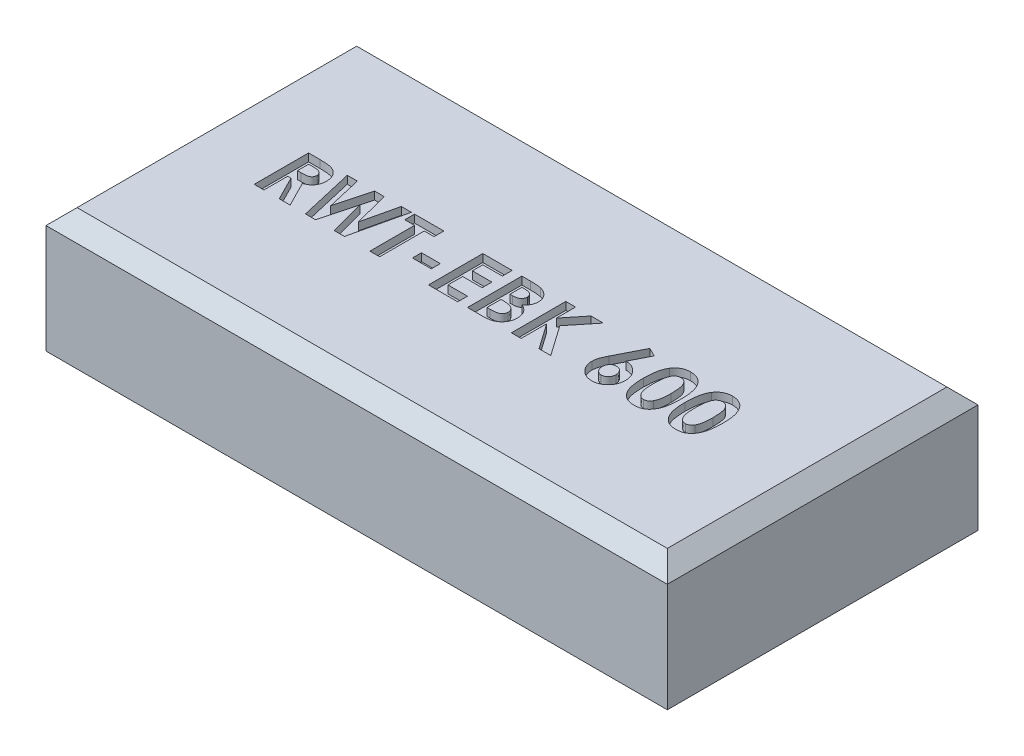
from build123d import *

# Parameters (mm, degrees)
SKETCH1_W           = 40
SKETCH1_H           = 20
BOSS_EXTRUDE1_DEPTH = 8
CHAMFER1_SIZE       = 1
SKETCH4_W           = 1.211538461
SKETCH4_H           = 0.583333333
CUT_EXTRUDE3_DEPTH  = 0.5


with BuildPart() as part:
    # Sketch1 → Boss-Extrude1 (new body)
    with BuildSketch(Plane(origin=(0, 0, 0), x_dir=(1, 0, 0), z_dir=(0, 1, 0))):
        with Locations((0, 2.318501171)):
            Rectangle(SKETCH1_W, SKETCH1_H)
    extrude(amount=BOSS_EXTRUDE1_DEPTH)

    # Chamfer1
    chamfer1_edges = [part.edges().sort_by_distance(p)[0] for p in [
        (0, 8, 7.681498829),
        (-20, 8, -2.318501171),
        (0, 8, -12.318501171),
        (20, 8, -2.318501171),
    ]]
    chamfer(chamfer1_edges, length=CHAMFER1_SIZE)

    # Sketch4 → Cut-Extrude3 (cut)
    # profile 1 of 10: a face of its own
    with BuildSketch(Plane(origin=(0, 8, 0), x_dir=(1, 0, 0), z_dir=(0, 1, 0))):
        with BuildLine():
            Line((-14.596153846, 3.818501171), (-13.864182692, 3.818501171))
            add(Edge.make_bspline(
                [(-13.864182692, 3.818501171), (-13.815799622, 3.818329439), (-13.722745349, 3.81799915), (-13.588566169, 3.81278806), (-13.46530414, 3.805536401), (-13.352776761, 3.794470177), (-13.251032173, 3.779797701), (-13.159968404, 3.76250128), (-13.079588115, 3.742788301), (-13.009213411, 3.718224373), (-12.945703721, 3.690516634), (-12.886503859, 3.658679935), (-12.830307791, 3.623068786), (-12.777491125, 3.582746162), (-12.727594872, 3.538437457), (-12.6805249, 3.49009807), (-12.636946351, 3.437318103), (-12.597129066, 3.380431058), (-12.560838815, 3.320587191), (-12.528765845, 3.257704336), (-12.502684052, 3.191738763), (-12.479637993, 3.123643816), (-12.463038663, 3.052446065), (-12.451494071, 2.978838632), (-12.443041573, 2.902562411), (-12.442555595, 2.850743733), (-12.442307692, 2.824310466)],
                knots=[0, 0, 0, 0, 1.749336639, 3.364467119, 4.854658419, 6.213483162, 7.451590619, 8.570285859, 9.5643256, 10.440900261, 11.26203566, 12.067320669, 12.869050712, 13.665104639, 14.467235401, 15.27997916, 16.102287765, 16.939272006, 17.78853747, 18.631303466, 19.488103222, 20.351255419, 21.228522269, 22.127379805, 23.044756219, 24, 24, 24, 24], degree=3))
            add(Edge.make_bspline(
                [(-12.442307692, 2.824310466), (-12.442951654, 2.796720207), (-12.444214347, 2.742620739), (-12.451015895, 2.663153032), (-12.46344699, 2.587123888), (-12.48227569, 2.514755912), (-12.503916836, 2.4451484), (-12.532694008, 2.379585653), (-12.565171892, 2.317114157), (-12.603744925, 2.258617595), (-12.646076944, 2.20279664), (-12.695308193, 2.151790002), (-12.748249241, 2.102856265), (-12.807876098, 2.059060474), (-12.871560358, 2.017441316), (-12.940567358, 1.979723274), (-13.014446736, 1.944958206), (-13.066387598, 1.925570802), (-13.092948718, 1.91565662)],
                knots=[0, 0, 0, 0, 1.099860209, 2.156625411, 3.176576793, 4.16617041, 5.135385252, 6.078461593, 7.016046972, 7.938469504, 8.868247731, 9.803980173, 10.76021508, 11.73834243, 12.748633912, 13.790971185, 14.870363756, 16, 16, 16, 16], degree=3))
            Line((-13.092948718, 1.91565662), (-12.28525641, 0.318501171))
            Line((-12.28525641, 0.318501171), (-12.983573718, 0.318501171))
            Line((-12.983573718, 0.318501171), (-13.754807692, 1.844142197))
            Line((-13.754807692, 1.844142197), (-13.967948718, 1.844142197))
            Line((-13.967948718, 1.844142197), (-13.967948718, 0.318501171))
            Line((-13.967948718, 0.318501171), (-14.596153846, 0.318501171))
            Line((-14.596153846, 0.318501171), (-14.596153846, 3.818501171))
        make_face()
        with BuildLine():
            Line((-13.967948718, 2.472347325), (-13.723257212, 2.472347325))
            add(Edge.make_bspline(
                [(-13.723257212, 2.472347325), (-13.693341641, 2.472684254), (-13.636059751, 2.473329401), (-13.55368087, 2.476321861), (-13.4788612, 2.483532211), (-13.41127944, 2.492642218), (-13.350595524, 2.503161037), (-13.297350732, 2.518235143), (-13.250724642, 2.534387429), (-13.211269776, 2.554460531), (-13.177560445, 2.577288002), (-13.148454596, 2.603220576), (-13.124379885, 2.633234229), (-13.104565169, 2.666513318), (-13.089151475, 2.70335219), (-13.07790066, 2.743346436), (-13.071613117, 2.786951643), (-13.070889714, 2.817045173), (-13.070512821, 2.832723927)],
                knots=[0, 0, 0, 0, 1.688639943, 3.233382647, 4.650958383, 5.928841754, 7.082724185, 8.122798841, 9.049171256, 9.863274652, 10.613301712, 11.341792392, 12.054588806, 12.776240173, 13.521029143, 14.301969904, 15.115324896, 16, 16, 16, 16], degree=3))
            add(Edge.make_bspline(
                [(-13.070512821, 2.832723927), (-13.071225372, 2.851273039), (-13.072625049, 2.88770933), (-13.086514186, 2.940164814), (-13.108622693, 2.988715953), (-13.1389274, 3.033143381), (-13.177092239, 3.072091531), (-13.220889403, 3.106424636), (-13.27126414, 3.133572687), (-13.317907356, 3.151479252), (-13.36034178, 3.162192934), (-13.398637509, 3.170176676), (-13.442984193, 3.175834983), (-13.493415313, 3.181836624), (-13.549802317, 3.185728385), (-13.612452548, 3.188568594), (-13.681186076, 3.189730664), (-13.729099873, 3.190102157), (-13.754106571, 3.190296043)],
                knots=[0, 0, 0, 0, 1.020303359, 2.004196876, 2.966617323, 3.9489082, 4.950758222, 5.960522915, 7.003732012, 8.091992268, 8.70421221, 9.413913587, 10.24622431, 11.166358409, 12.212345909, 13.359657661, 14.621978493, 16, 16, 16, 16], degree=3))
            Line((-13.754106571, 3.190296043), (-13.967948718, 3.190296043))
            Line((-13.967948718, 3.190296043), (-13.967948718, 2.472347325))
        make_face(mode=Mode.SUBTRACT)
    # profile 2 of 10: a face of its own
    with BuildSketch(Plane(origin=(0, 8, 0), x_dir=(1, 0, 0), z_dir=(0, 1, 0))):
        Polygon((-12.105769231, 3.818501171), (-11.457231571, 3.818501171), (-10.939102564, 1.584026011), (-10.345252404, 3.818501171), (-9.734575321, 3.818501171), (-9.144230769, 1.584026011), (-8.627504006, 3.818501171), (-7.977564103, 3.818501171), (-8.787359776, 0.318501171), (-9.443609776, 0.318501171), (-10.041666667, 2.581021203), (-10.643229167, 0.318501171), (-11.294571314, 0.318501171), align=None)
    # profile 3 of 10: a face of its own
    with BuildSketch(Plane(origin=(0, 8, 0), x_dir=(1, 0, 0), z_dir=(0, 1, 0))):
        Polygon((-7.775641026, 3.818501171), (-5.891025641, 3.818501171), (-5.891025641, 3.190296043), (-6.519230769, 3.190296043), (-6.519230769, 0.318501171), (-7.147435897, 0.318501171), (-7.147435897, 3.190296043), (-7.775641026, 3.190296043), align=None)
    # profile 4 of 10: a face of its own
    with BuildSketch(Plane(origin=(0, 8, 0), x_dir=(1, 0, 0), z_dir=(0, 1, 0))):
        with Locations((-4.791666667, 1.597347325)):
            Rectangle(SKETCH4_W, SKETCH4_H)
    # profile 5 of 10: a face of its own
    with BuildSketch(Plane(origin=(0, 8, 0), x_dir=(1, 0, 0), z_dir=(0, 1, 0))):
        Polygon((-3.378205128, 3.818501171), (-1.493589744, 3.818501171), (-1.493589744, 3.190296043), (-2.75, 3.190296043), (-2.75, 2.51721912), (-1.493589744, 2.51721912), (-1.493589744, 1.889013991), (-2.75, 1.889013991), (-2.75, 0.946706299), (-1.493589744, 0.946706299), (-1.493589744, 0.318501171), (-3.378205128, 0.318501171), align=None)
    # profile 6 of 10: a face of its own
    with BuildSketch(Plane(origin=(0, 8, 0), x_dir=(1, 0, 0), z_dir=(0, 1, 0))):
        with BuildLine():
            Line((-0.865384615, 0.318501171), (-0.865384615, 3.818501171))
            Line((-0.865384615, 3.818501171), (-0.304487179, 3.818501171))
            add(Edge.make_bspline(
                [(-0.304487179, 3.818501171), (-0.265220852, 3.818505652), (-0.189241252, 3.818514323), (-0.079622519, 3.814664873), (0.022039599, 3.809685178), (0.115421572, 3.804114058), (0.200682344, 3.794513904), (0.277692262, 3.784396391), (0.346605192, 3.772195293), (0.389210312, 3.76125053), (0.409254808, 3.756101331)],
                knots=[0, 0, 0, 0, 1.311965854, 2.538629056, 3.664479157, 4.713267157, 5.663616078, 6.530575999, 7.308677837, 8, 8, 8, 8], degree=3))
            add(Edge.make_bspline(
                [(0.409254808, 3.756101331), (0.435575266, 3.748838294), (0.487224455, 3.734585883), (0.561202576, 3.705802524), (0.631381143, 3.673807779), (0.697674471, 3.637307759), (0.759675491, 3.595861807), (0.817148578, 3.549140995), (0.871333285, 3.499020694), (0.920305637, 3.444104065), (0.964568575, 3.386074475), (1.003025131, 3.324947127), (1.03643895, 3.2616567), (1.063178757, 3.195406725), (1.083326699, 3.126502301), (1.09806282, 3.055237661), (1.107613822, 2.981387306), (1.108516267, 2.931144495), (1.108974359, 2.905640594)],
                knots=[0, 0, 0, 0, 1.099996261, 2.158545794, 3.195537121, 4.207578794, 5.205712374, 6.197378256, 7.190519799, 8.17788031, 9.159561366, 10.129234751, 11.085776129, 12.040971148, 13.00380137, 13.975669004, 14.972423361, 16, 16, 16, 16], degree=3))
            add(Edge.make_bspline(
                [(1.108974359, 2.905640594), (1.107776583, 2.872874775), (1.105418909, 2.808379286), (1.090357925, 2.713647082), (1.062116233, 2.624111532), (1.025162666, 2.538122532), (0.974917368, 2.456000819), (0.911115557, 2.377785442), (0.834790614, 2.30106803), (0.776245169, 2.255081117), (0.745793269, 2.231161427)],
                knots=[0, 0, 0, 0, 0.986156485, 1.941127874, 2.875419072, 3.804401753, 4.751181392, 5.761612777, 6.835722519, 8, 8, 8, 8], degree=3))
            add(Edge.make_bspline(
                [(0.745793269, 2.231161427), (0.770470028, 2.218564156), (0.818854324, 2.193864392), (0.887545811, 2.153265354), (0.951146629, 2.110083128), (1.009941945, 2.065186558), (1.062698461, 2.016672412), (1.111594582, 1.967336144), (1.154218027, 1.914350989), (1.192333195, 1.85960544), (1.225462281, 1.802306775), (1.254314061, 1.742551757), (1.278684124, 1.680136252), (1.299321324, 1.615377904), (1.314712554, 1.548053973), (1.324747963, 1.478140383), (1.332431699, 1.405875574), (1.333029422, 1.35665059), (1.333333333, 1.331622165)],
                knots=[0, 0, 0, 0, 1.164658916, 2.283573913, 3.35186032, 4.395461096, 5.390182219, 6.362969632, 7.312859996, 8.245001507, 9.165155236, 10.092416118, 11.032087915, 11.979892451, 12.947605196, 13.931445124, 14.948243989, 16, 16, 16, 16], degree=3))
            add(Edge.make_bspline(
                [(1.333333333, 1.331622165), (1.331361149, 1.283819302), (1.327469051, 1.189480545), (1.29901193, 1.050969584), (1.249676325, 0.91964863), (1.18342878, 0.796039608), (1.101799059, 0.683720797), (1.007948289, 0.585330494), (0.902821331, 0.502045287), (0.805829006, 0.445834233), (0.721938284, 0.40811136), (0.652453165, 0.384788701), (0.577827621, 0.363182624), (0.49669469, 0.348010391), (0.410525202, 0.334123096), (0.318478999, 0.325548791), (0.220728113, 0.319738197), (0.153588579, 0.318921849), (0.118990385, 0.318501171)],
                knots=[0, 0, 0, 0, 1.284142165, 2.534249414, 3.780121997, 5.041676246, 6.291546858, 7.49970053, 8.684500223, 9.883330709, 10.50184324, 11.153274765, 11.851151195, 12.587658647, 13.369265475, 14.195992086, 15.070362669, 16, 16, 16, 16], degree=3))
            Line((0.118990385, 0.318501171), (-0.865384615, 0.318501171))
        make_face()
        with BuildLine():
            Line((-0.237179487, 3.190296043), (-0.237179487, 2.42747553))
            Line((-0.237179487, 2.42747553), (-0.0703125, 2.42747553))
            add(Edge.make_bspline(
                [(-0.0703125, 2.42747553), (-0.047633777, 2.427673297), (-0.003853875, 2.428055074), (0.059381549, 2.432972233), (0.118180282, 2.441361212), (0.172319311, 2.453065948), (0.222302963, 2.467929257), (0.267811927, 2.485813017), (0.308646108, 2.507633149), (0.356085982, 2.540135198), (0.406233349, 2.587963419), (0.450377513, 2.657061193), (0.476378131, 2.736523371), (0.479273899, 2.792566252), (0.480769231, 2.821505979)],
                knots=[0, 0, 0, 0, 1.065314748, 2.056525647, 2.977365736, 3.853934255, 4.656397591, 5.425096493, 6.14721249, 6.826394842, 8.123232004, 9.372140726, 10.643011755, 12, 12, 12, 12], degree=3))
            add(Edge.make_bspline(
                [(0.480769231, 2.821505979), (0.479572691, 2.848612841), (0.47725923, 2.901022871), (0.451079951, 2.97461122), (0.410418355, 3.039825558), (0.362411626, 3.084459439), (0.317203962, 3.114943064), (0.278494386, 3.135015233), (0.236007719, 3.152983634), (0.188921466, 3.166722711), (0.137504514, 3.17703203), (0.082006625, 3.184602991), (0.022332045, 3.189756109), (-0.018885315, 3.190112204), (-0.040164263, 3.190296043)],
                knots=[0, 0, 0, 0, 1.347982417, 2.606269829, 3.849316587, 5.153353503, 5.842674298, 6.568177932, 7.326619318, 8.142485038, 9.012069166, 9.942760135, 10.937925643, 12, 12, 12, 12], degree=3))
            Line((-0.040164263, 3.190296043), (-0.237179487, 3.190296043))
        make_face(mode=Mode.SUBTRACT)
        with BuildLine():
            Line((-0.237179487, 1.844142197), (-0.237179487, 0.946706299))
            Line((-0.237179487, 0.946706299), (-0.056290064, 0.946706299))
            add(Edge.make_bspline(
                [(-0.056290064, 0.946706299), (-0.020527995, 0.946910607), (0.048229046, 0.947303413), (0.146723385, 0.952049449), (0.236279363, 0.960603342), (0.316659689, 0.971282188), (0.387987483, 0.985750355), (0.450021639, 1.004144774), (0.503612874, 1.02438184), (0.548439854, 1.049377018), (0.585060929, 1.078465208), (0.618107609, 1.108194036), (0.645051813, 1.142489048), (0.666370569, 1.179878054), (0.684821916, 1.219432285), (0.695950465, 1.262696318), (0.704423352, 1.308387911), (0.704889637, 1.339991798), (0.705128205, 1.356161427)],
                knots=[0, 0, 0, 0, 1.753078804, 3.370512758, 4.83203934, 6.162291463, 7.344201807, 8.395507345, 9.331626367, 10.147333109, 10.898971645, 11.62040215, 12.321813352, 13.025280112, 13.727906689, 14.453419512, 15.208716525, 16, 16, 16, 16], degree=3))
            add(Edge.make_bspline(
                [(0.705128205, 1.356161427), (0.704602095, 1.374651653), (0.703577374, 1.410665639), (0.695208464, 1.463303922), (0.67999942, 1.512445252), (0.660842888, 1.559346239), (0.634185556, 1.602327663), (0.602504228, 1.642876951), (0.564225095, 1.679620976), (0.521177978, 1.714782156), (0.470967777, 1.745567673), (0.413570936, 1.772279563), (0.348675643, 1.79458835), (0.27608088, 1.81235062), (0.196104895, 1.827425213), (0.108163951, 1.83642641), (0.012990452, 1.843120995), (-0.053004401, 1.843794061), (-0.087139423, 1.844142197)],
                knots=[0, 0, 0, 0, 0.845221588, 1.646264278, 2.427170338, 3.19324141, 3.95557735, 4.731569926, 5.540061037, 6.376114724, 7.268642756, 8.224665384, 9.265483498, 10.400594375, 11.639216012, 12.983232105, 14.439614077, 16, 16, 16, 16], degree=3))
            Line((-0.087139423, 1.844142197), (-0.237179487, 1.844142197))
        make_face(mode=Mode.SUBTRACT)
    # profile 7 of 10: a face of its own
    with BuildSketch(Plane(origin=(0, 8, 0), x_dir=(1, 0, 0), z_dir=(0, 1, 0))):
        Polygon((1.961538462, 3.818501171), (2.58974359, 3.818501171), (2.58974359, 2.586630177), (3.582532051, 3.818501171), (4.375500801, 3.818501171), (3.128205128, 2.270424248), (4.496794872, 0.318501171), (3.740284455, 0.318501171), (2.58974359, 1.959827293), (2.58974359, 0.318501171), (1.961538462, 0.318501171), align=None)
    # profile 8 of 10: a face of its own
    with BuildSketch(Plane(origin=(0, 8, 0), x_dir=(1, 0, 0), z_dir=(0, 1, 0))):
        with BuildLine():
            Line((7.287259615, 3.908244761), (7.843249199, 3.626393799))
            Line((7.843249199, 3.626393799), (7.233273237, 2.42747553))
            add(Edge.make_bspline(
                [(7.233273237, 2.42747553), (7.269310045, 2.426542519), (7.340290447, 2.4247048), (7.444723706, 2.409852053), (7.544563845, 2.384175214), (7.640817549, 2.350140634), (7.732308207, 2.304431854), (7.820509327, 2.250058876), (7.903139102, 2.183745181), (7.982092161, 2.110273125), (8.053883772, 2.028876646), (8.116247478, 1.941413544), (8.170596347, 1.850011807), (8.21284497, 1.752626555), (8.246924117, 1.650872061), (8.271513721, 1.544341567), (8.285542778, 1.432726586), (8.287476918, 1.356901473), (8.288461538, 1.31830085)],
                knots=[0, 0, 0, 0, 1.013260694, 1.995783107, 2.958651975, 3.908806537, 4.861209129, 5.829647963, 6.817170299, 7.835534541, 8.860094905, 9.863329007, 10.853101798, 11.844815043, 12.84250023, 13.867713965, 14.914507806, 16, 16, 16, 16], degree=3))
            add(Edge.make_bspline(
                [(8.288461538, 1.31830085), (8.287538867, 1.281092192), (8.285715142, 1.20754663), (8.270639637, 1.099526903), (8.246276829, 0.995888293), (8.211457485, 0.896837778), (8.167199282, 0.801891196), (8.113074498, 0.711104263), (8.048634272, 0.6251554), (7.975543562, 0.544501298), (7.895642808, 0.470984488), (7.81142306, 0.405638468), (7.722170652, 0.351660177), (7.629572559, 0.306074244), (7.531923994, 0.272057263), (7.430686271, 0.246380336), (7.325091675, 0.231563634), (7.253416769, 0.229700417), (7.217147436, 0.228757581)],
                knots=[0, 0, 0, 0, 1.049934834, 2.075270938, 3.072134561, 4.05064612, 5.033440221, 6.024524368, 7.028587226, 8.060776465, 9.092543989, 10.090062252, 11.064205434, 12.031961459, 12.998029633, 13.977230324, 14.976426867, 16, 16, 16, 16], degree=3))
            add(Edge.make_bspline(
                [(7.217147436, 0.228757581), (7.179220735, 0.229531316), (7.104643009, 0.231052761), (6.995517131, 0.248088938), (6.890856023, 0.273734527), (6.791247896, 0.31035207), (6.696073317, 0.356977567), (6.606452795, 0.414671928), (6.521631401, 0.482798942), (6.442513456, 0.559825856), (6.371234084, 0.644198302), (6.307658842, 0.731798868), (6.253874104, 0.822765019), (6.210336613, 0.916999493), (6.176367653, 1.01420201), (6.152732185, 1.114557051), (6.137331496, 1.217798425), (6.135526117, 1.287863863), (6.134615385, 1.323208703)],
                knots=[0, 0, 0, 0, 1.063775006, 2.091769615, 3.092589432, 4.084662827, 5.064601646, 6.061867366, 7.070035304, 8.113879863, 9.156342271, 10.166834137, 11.149076039, 12.117706134, 13.076241869, 14.034148791, 15.008317125, 16, 16, 16, 16], degree=3))
            add(Edge.make_bspline(
                [(6.134615385, 1.323208703), (6.135096598, 1.350579146), (6.136061702, 1.405472389), (6.145760426, 1.487672036), (6.160505893, 1.570087449), (6.17759782, 1.639632185), (6.19519736, 1.698439537), (6.212911432, 1.748206609), (6.234864121, 1.803437178), (6.259959296, 1.86427228), (6.28898611, 1.930638729), (6.321792931, 2.002355629), (6.358461434, 2.079966073), (6.384611127, 2.133272431), (6.398237179, 2.161049248)],
                knots=[0, 0, 0, 0, 1.110454016, 2.227089276, 3.35462975, 4.507227546, 5.131400587, 5.845402449, 6.650387134, 7.543487832, 8.516250726, 9.590168902, 10.744287919, 12, 12, 12, 12], degree=3))
            Line((6.398237179, 2.161049248), (7.287259615, 3.908244761))
        make_face()
        with BuildLine():
            add(Edge.make_bspline(
                [(7.203125, 1.844142197), (7.172981806, 1.842759592), (7.113995532, 1.840054016), (7.030125872, 1.81171991), (6.953655771, 1.767270749), (6.887370541, 1.705366696), (6.831929046, 1.631388922), (6.79118869, 1.547007389), (6.766681101, 1.453348146), (6.76413492, 1.387863165), (6.762820513, 1.354058062)],
                knots=[0, 0, 0, 0, 0.981744412, 1.921144944, 2.858899012, 3.85339082, 4.86292663, 5.863643845, 6.897155691, 8, 8, 8, 8], degree=3))
            add(Edge.make_bspline(
                [(6.762820513, 1.354058062), (6.764376812, 1.320241702), (6.767403918, 1.254466622), (6.792833024, 1.159915576), (6.83446836, 1.073617836), (6.892859264, 0.998659696), (6.961409347, 0.936438636), (7.037423258, 0.890423187), (7.119633057, 0.862154387), (7.176499583, 0.858705218), (7.205228365, 0.856962709)],
                knots=[0, 0, 0, 0, 1.098279937, 2.136227893, 3.159405121, 4.194678092, 5.206500211, 6.154139736, 7.067477469, 8, 8, 8, 8], degree=3))
            add(Edge.make_bspline(
                [(7.205228365, 0.856962709), (7.235569206, 0.858736253), (7.295072865, 0.862214481), (7.380910794, 0.889293782), (7.459324258, 0.934538321), (7.528656928, 0.996560175), (7.588212374, 1.070662942), (7.629418727, 1.157467583), (7.656023432, 1.252701065), (7.658813782, 1.319514894), (7.66025641, 1.354058062)],
                knots=[0, 0, 0, 0, 0.96921794, 1.900804717, 2.848419905, 3.844199796, 4.861108892, 5.867439427, 6.897452859, 8, 8, 8, 8], degree=3))
            add(Edge.make_bspline(
                [(7.66025641, 1.354058062), (7.658612993, 1.387843426), (7.655430323, 1.453272729), (7.631524703, 1.547370744), (7.588842831, 1.631427039), (7.532146927, 1.705672064), (7.463580512, 1.767548514), (7.384049921, 1.81207045), (7.296348955, 1.840003817), (7.234652722, 1.842742624), (7.203125, 1.844142197)],
                knots=[0, 0, 0, 0, 1.083229974, 2.097801324, 3.086792542, 4.086858909, 5.079819718, 6.026392613, 6.991456328, 8, 8, 8, 8], degree=3))
        make_face(mode=Mode.SUBTRACT)
    # profile 9 of 10: a face of its own
    with BuildSketch(Plane(origin=(0, 8, 0), x_dir=(1, 0, 0), z_dir=(0, 1, 0))):
        with BuildLine():
            add(Edge.make_bspline(
                [(9.915765224, 3.908244761), (9.94617296, 3.907793349), (10.005962692, 3.906905754), (10.094021714, 3.897292372), (10.178846898, 3.882769234), (10.260770092, 3.86251452), (10.339201605, 3.835708128), (10.414712276, 3.803621336), (10.48640331, 3.764571127), (10.555188998, 3.720461909), (10.621042843, 3.670524021), (10.682382094, 3.613592251), (10.740326935, 3.550976601), (10.793623075, 3.481730434), (10.843450772, 3.406483618), (10.889646302, 3.325224221), (10.931856026, 3.237554532), (10.970553014, 3.143316345), (11.005155982, 3.04109707), (11.03430202, 2.929724208), (11.059299625, 2.809172324), (11.080399367, 2.679141347), (11.096347361, 2.539458435), (11.107096631, 2.390216385), (11.114473288, 2.231702915), (11.115075319, 2.122963977), (11.115384615, 2.067098927)],
                knots=[0, 0, 0, 0, 0.879237366, 1.728815576, 2.559023295, 3.367336655, 4.166867292, 4.954216142, 5.737608147, 6.525189134, 7.316157332, 8.124696809, 8.942788509, 9.781158001, 10.649253743, 11.551476218, 12.482711956, 13.461909668, 14.496590415, 15.601789533, 16.789733467, 18.056700938, 19.410929216, 20.8549011, 22.384193279, 24, 24, 24, 24], degree=3))
            add(Edge.make_bspline(
                [(11.115384615, 2.067098927), (11.11505035, 2.010534943), (11.114400879, 1.900632136), (11.10740328, 1.740668821), (11.095353086, 1.590343185), (11.079821925, 1.449670779), (11.058548484, 1.31872589), (11.033634327, 1.19716946), (11.004028228, 1.085045549), (10.968285448, 0.982606796), (10.929822694, 0.888203106), (10.887497509, 0.800704352), (10.842047614, 0.71987354), (10.794515494, 0.644491226), (10.742295263, 0.576779642), (10.687928626, 0.514436242), (10.629048363, 0.459835764), (10.568133562, 0.410164346), (10.502952665, 0.367238273), (10.434177868, 0.329695837), (10.360583034, 0.299244462), (10.283509672, 0.272759483), (10.201644051, 0.253746125), (10.116287005, 0.238659651), (10.026474869, 0.23032194), (9.96532715, 0.229287592), (9.933994391, 0.228757581)],
                knots=[0, 0, 0, 0, 1.643780988, 3.193836972, 4.651895693, 6.025988579, 7.305620092, 8.505800249, 9.631074763, 10.672816429, 11.65661981, 12.592235626, 13.49536222, 14.350718032, 15.179365177, 15.97804903, 16.751647189, 17.51006938, 18.259804725, 19.016521909, 19.783502495, 20.571750527, 21.382245291, 22.22305063, 23.089471752, 24, 24, 24, 24], degree=3))
            add(Edge.make_bspline(
                [(9.933994391, 0.228757581), (9.902662478, 0.229297816), (9.841283721, 0.230356128), (9.751228725, 0.238597657), (9.665419329, 0.253807241), (9.58290602, 0.272905453), (9.504263076, 0.299185861), (9.429113408, 0.330548319), (9.358034851, 0.367856509), (9.2908306, 0.410882596), (9.227730109, 0.460221675), (9.167752798, 0.515346009), (9.111031339, 0.576115872), (9.058428606, 0.643211936), (9.00908312, 0.71573861), (8.963509474, 0.794524112), (8.921735059, 0.879453732), (8.882453162, 0.970645855), (8.848322166, 1.070063741), (8.817947164, 1.17859518), (8.793064761, 1.297144871), (8.773052668, 1.425674728), (8.757075024, 1.563912456), (8.745189494, 1.711924777), (8.738153027, 1.869780633), (8.737510367, 1.978282826), (8.737179487, 2.034146203)],
                knots=[0, 0, 0, 0, 0.917216111, 1.796812873, 2.643793957, 3.46689424, 4.273913431, 5.068098542, 5.848489301, 6.620921603, 7.401012384, 8.190319798, 9.003608147, 9.831726257, 10.68377682, 11.569763213, 12.493818149, 13.453288342, 14.474581811, 15.568529029, 16.750744269, 18.018426408, 19.375425659, 20.823733699, 22.36466933, 24, 24, 24, 24], degree=3))
            add(Edge.make_bspline(
                [(8.737179487, 2.034146203), (8.737778845, 2.111763968), (8.738935314, 2.261528446), (8.753590934, 2.477894573), (8.775101668, 2.677887577), (8.80669584, 2.861172919), (8.845761597, 3.028429436), (8.895787333, 3.178555327), (8.952737994, 3.313627923), (9.001267274, 3.393645742), (9.024639423, 3.432183062)],
                knots=[0, 0, 0, 0, 1.288568992, 2.486310467, 3.599230591, 4.627010532, 5.572937695, 6.447898582, 7.252493626, 8, 8, 8, 8], degree=3))
            add(Edge.make_bspline(
                [(9.024639423, 3.432183062), (9.051815445, 3.470042113), (9.104949923, 3.544064019), (9.197857043, 3.641240945), (9.297673647, 3.72435141), (9.406449911, 3.791514551), (9.522465493, 3.844479409), (9.646716447, 3.881887892), (9.778743933, 3.903683818), (9.869409411, 3.906701743), (9.915765224, 3.908244761)],
                knots=[0, 0, 0, 0, 1.058512271, 2.069600068, 3.047294572, 4.004278952, 4.967380941, 5.939006123, 6.946246673, 8, 8, 8, 8], degree=3))
        make_face()
        with BuildLine():
            add(Edge.make_bspline(
                [(9.931189904, 3.280039632), (9.903701059, 3.278736716), (9.84980833, 3.276182308), (9.771607414, 3.254498986), (9.697868832, 3.221007927), (9.641777862, 3.180706674), (9.599794329, 3.142073089), (9.570460134, 3.107110952), (9.542171926, 3.068095726), (9.517186356, 3.023266856), (9.493593455, 2.974235095), (9.47053608, 2.920777869), (9.451635087, 2.861582152), (9.433065363, 2.797656056), (9.416796552, 2.727232193), (9.403166854, 2.649734927), (9.390989918, 2.564660285), (9.382496359, 2.471952543), (9.374577814, 2.371708697), (9.368901426, 2.263705442), (9.36652827, 2.147971914), (9.365773916, 2.068267952), (9.365384615, 2.027134985)],
                knots=[0, 0, 0, 0, 1.076674018, 2.110852608, 3.161083442, 4.239746716, 4.804137807, 5.395870207, 6.026861976, 6.692161227, 7.405688833, 8.16177676, 8.973626916, 9.841385931, 10.773283133, 11.807421078, 12.927755683, 14.143907515, 15.458935494, 16.872852025, 18.386167141, 20, 20, 20, 20], degree=3))
            add(Edge.make_bspline(
                [(9.365384615, 2.027134985), (9.366025357, 1.973845238), (9.367254027, 1.871658197), (9.373689226, 1.724709674), (9.386588049, 1.590974686), (9.40263158, 1.46954686), (9.425165374, 1.361213689), (9.451091964, 1.264950241), (9.483108996, 1.181983641), (9.520110846, 1.111114005), (9.561092062, 1.050825352), (9.605578975, 0.999579726), (9.652056964, 0.955203432), (9.70197676, 0.919157115), (9.755219267, 0.891532879), (9.81134001, 0.871663107), (9.870374652, 0.859499993), (9.910800967, 0.85781336), (9.931189904, 0.856962709)],
                knots=[0, 0, 0, 0, 1.771748488, 3.397459088, 4.888034009, 6.237357457, 7.467047327, 8.564189669, 9.548206622, 10.417051504, 11.216568818, 11.965764335, 12.669334354, 13.348544111, 14.005342236, 14.656555988, 15.322436492, 16, 16, 16, 16], degree=3))
            add(Edge.make_bspline(
                [(9.931189904, 0.856962709), (9.950879157, 0.857544788), (9.989428267, 0.858684424), (10.045641503, 0.87038264), (10.098800732, 0.889401398), (10.148745452, 0.916304766), (10.195654308, 0.950516515), (10.239298036, 0.992186986), (10.279347487, 1.041731537), (10.302680478, 1.07850092), (10.314703526, 1.097447485)],
                knots=[0, 0, 0, 0, 0.992283464, 1.942767638, 2.88273346, 3.832339453, 4.79467288, 5.803907806, 6.868395428, 8, 8, 8, 8], degree=3))
            add(Edge.make_bspline(
                [(10.314703526, 1.097447485), (10.328858639, 1.12333736), (10.358540763, 1.177626329), (10.392888969, 1.269236938), (10.421801373, 1.372558565), (10.446685858, 1.487912756), (10.463705327, 1.615754481), (10.478362473, 1.755273086), (10.485431979, 1.907171129), (10.486581872, 2.012406641), (10.487179487, 2.067098927)],
                knots=[0, 0, 0, 0, 0.710965849, 1.490837728, 2.352621235, 3.297892224, 4.334225155, 5.461620853, 6.680770821, 8, 8, 8, 8], degree=3))
            add(Edge.make_bspline(
                [(10.487179487, 2.067098927), (10.486948641, 2.122265969), (10.486504303, 2.228453106), (10.478351976, 2.380897234), (10.466999238, 2.520129644), (10.450393459, 2.645839487), (10.429027107, 2.758331932), (10.402692997, 2.857599625), (10.37164704, 2.943838204), (10.334830235, 3.016961676), (10.294053336, 3.079106596), (10.250767413, 3.132422118), (10.204789436, 3.177941565), (10.156196294, 3.215836235), (10.103863282, 3.244790606), (10.04879003, 3.265234787), (9.990863632, 3.27760283), (9.951349628, 3.279216402), (9.931189904, 3.280039632)],
                knots=[0, 0, 0, 0, 1.793836731, 3.452829483, 4.963243077, 6.335886805, 7.574563692, 8.684454726, 9.672768357, 10.54971625, 11.340229787, 12.085688095, 12.778991901, 13.440269426, 14.083255152, 14.715733572, 15.344777694, 16, 16, 16, 16], degree=3))
        make_face(mode=Mode.SUBTRACT)
    # profile 10 of 10: a face of its own
    with BuildSketch(Plane(origin=(0, 8, 0), x_dir=(1, 0, 0), z_dir=(0, 1, 0))):
        with BuildLine():
            add(Edge.make_bspline(
                [(12.608072917, 3.908244761), (12.638480652, 3.907793349), (12.698270385, 3.906905754), (12.786329406, 3.897292372), (12.871154591, 3.882769234), (12.953077785, 3.86251452), (13.031509297, 3.835708128), (13.107019968, 3.803621336), (13.178711003, 3.764571127), (13.247496691, 3.720461909), (13.313350535, 3.670524021), (13.374689786, 3.613592251), (13.432634627, 3.550976601), (13.485930767, 3.481730434), (13.535758465, 3.406483618), (13.581953994, 3.325224221), (13.624163718, 3.237554532), (13.662860706, 3.143316345), (13.697463675, 3.04109707), (13.726609713, 2.929724208), (13.751607317, 2.809172324), (13.772707059, 2.679141347), (13.788655053, 2.539458435), (13.799404323, 2.390216385), (13.80678098, 2.231702915), (13.807383012, 2.122963977), (13.807692308, 2.067098927)],
                knots=[0, 0, 0, 0, 0.879237366, 1.728815576, 2.559023295, 3.367336655, 4.166867292, 4.954216142, 5.737608147, 6.525189134, 7.316157332, 8.124696809, 8.942788509, 9.781158001, 10.649253743, 11.551476218, 12.482711956, 13.461909668, 14.496590415, 15.601789533, 16.789733467, 18.056700938, 19.410929216, 20.8549011, 22.384193279, 24, 24, 24, 24], degree=3))
            add(Edge.make_bspline(
                [(13.807692308, 2.067098927), (13.807358042, 2.010534943), (13.806708571, 1.900632136), (13.799710973, 1.740668821), (13.787660778, 1.590343185), (13.772129618, 1.449670779), (13.750856176, 1.31872589), (13.725942019, 1.19716946), (13.69633592, 1.085045549), (13.660593141, 0.982606796), (13.622130387, 0.888203106), (13.579805201, 0.800704352), (13.534355307, 0.71987354), (13.486823186, 0.644491226), (13.434602955, 0.576779642), (13.380236318, 0.514436242), (13.321356056, 0.459835764), (13.260441254, 0.410164346), (13.195260358, 0.367238273), (13.12648556, 0.329695837), (13.052890726, 0.299244462), (12.975817364, 0.272759483), (12.893951743, 0.253746125), (12.808594697, 0.238659651), (12.718782561, 0.23032194), (12.657634842, 0.229287592), (12.626302083, 0.228757581)],
                knots=[0, 0, 0, 0, 1.643780988, 3.193836972, 4.651895693, 6.025988579, 7.305620092, 8.505800249, 9.631074763, 10.672816429, 11.65661981, 12.592235626, 13.49536222, 14.350718032, 15.179365177, 15.97804903, 16.751647189, 17.51006938, 18.259804725, 19.016521909, 19.783502495, 20.571750527, 21.382245291, 22.22305063, 23.089471752, 24, 24, 24, 24], degree=3))
            add(Edge.make_bspline(
                [(12.626302083, 0.228757581), (12.59497017, 0.229297816), (12.533591414, 0.230356128), (12.443536417, 0.238597657), (12.357727022, 0.253807241), (12.275213712, 0.272905453), (12.196570768, 0.299185861), (12.1214211, 0.330548319), (12.050342543, 0.367856509), (11.983138292, 0.410882596), (11.920037802, 0.460221675), (11.86006049, 0.515346009), (11.803339031, 0.576115872), (11.750736299, 0.643211936), (11.701390812, 0.71573861), (11.655817167, 0.794524112), (11.614042751, 0.879453732), (11.574760854, 0.970645855), (11.540629858, 1.070063741), (11.510254856, 1.17859518), (11.485372454, 1.297144871), (11.46536036, 1.425674728), (11.449382717, 1.563912456), (11.437497186, 1.711924777), (11.43046072, 1.869780633), (11.429818059, 1.978282826), (11.429487179, 2.034146203)],
                knots=[0, 0, 0, 0, 0.917216111, 1.796812873, 2.643793957, 3.46689424, 4.273913431, 5.068098542, 5.848489301, 6.620921603, 7.401012384, 8.190319798, 9.003608147, 9.831726257, 10.68377682, 11.569763213, 12.493818149, 13.453288342, 14.474581811, 15.568529029, 16.750744269, 18.018426408, 19.375425659, 20.823733699, 22.36466933, 24, 24, 24, 24], degree=3))
            add(Edge.make_bspline(
                [(11.429487179, 2.034146203), (11.430086537, 2.111763968), (11.431243006, 2.261528446), (11.445898626, 2.477894573), (11.46740936, 2.677887577), (11.499003532, 2.861172919), (11.538069289, 3.028429436), (11.588095025, 3.178555327), (11.645045686, 3.313627923), (11.693574966, 3.393645742), (11.716947115, 3.432183062)],
                knots=[0, 0, 0, 0, 1.288568992, 2.486310467, 3.599230591, 4.627010532, 5.572937695, 6.447898582, 7.252493626, 8, 8, 8, 8], degree=3))
            add(Edge.make_bspline(
                [(11.716947115, 3.432183062), (11.744123137, 3.470042113), (11.797257615, 3.544064019), (11.890164735, 3.641240945), (11.989981339, 3.72435141), (12.098757603, 3.791514551), (12.214773185, 3.844479409), (12.339024139, 3.881887892), (12.471051626, 3.903683818), (12.561717103, 3.906701743), (12.608072917, 3.908244761)],
                knots=[0, 0, 0, 0, 1.058512271, 2.069600068, 3.047294572, 4.004278952, 4.967380941, 5.939006123, 6.946246673, 8, 8, 8, 8], degree=3))
        make_face()
        with BuildLine():
            add(Edge.make_bspline(
                [(12.623497596, 3.280039632), (12.596008751, 3.278736716), (12.542116023, 3.276182308), (12.463915106, 3.254498986), (12.390176524, 3.221007927), (12.334085555, 3.180706674), (12.292102022, 3.142073089), (12.262767826, 3.107110952), (12.234479618, 3.068095726), (12.209494048, 3.023266856), (12.185901148, 2.974235095), (12.162843773, 2.920777869), (12.14394278, 2.861582152), (12.125373055, 2.797656056), (12.109104244, 2.727232193), (12.095474546, 2.649734927), (12.08329761, 2.564660285), (12.074804052, 2.471952543), (12.066885506, 2.371708697), (12.061209118, 2.263705442), (12.058835962, 2.147971914), (12.058081608, 2.068267952), (12.057692308, 2.027134985)],
                knots=[0, 0, 0, 0, 1.076674018, 2.110852608, 3.161083442, 4.239746716, 4.804137807, 5.395870207, 6.026861976, 6.692161227, 7.405688833, 8.16177676, 8.973626916, 9.841385931, 10.773283133, 11.807421078, 12.927755683, 14.143907515, 15.458935494, 16.872852025, 18.386167141, 20, 20, 20, 20], degree=3))
            add(Edge.make_bspline(
                [(12.057692308, 2.027134985), (12.05833305, 1.973845238), (12.05956172, 1.871658197), (12.065996919, 1.724709674), (12.078895741, 1.590974686), (12.094939272, 1.46954686), (12.117473067, 1.361213689), (12.143399656, 1.264950241), (12.175416688, 1.181983641), (12.212418538, 1.111114005), (12.253399754, 1.050825352), (12.297886667, 0.999579726), (12.344364656, 0.955203432), (12.394284452, 0.919157115), (12.44752696, 0.891532879), (12.503647703, 0.871663107), (12.562682345, 0.859499993), (12.603108659, 0.85781336), (12.623497596, 0.856962709)],
                knots=[0, 0, 0, 0, 1.771748488, 3.397459088, 4.888034009, 6.237357457, 7.467047327, 8.564189669, 9.548206622, 10.417051504, 11.216568818, 11.965764335, 12.669334354, 13.348544111, 14.005342236, 14.656555988, 15.322436492, 16, 16, 16, 16], degree=3))
            add(Edge.make_bspline(
                [(12.623497596, 0.856962709), (12.64318685, 0.857544788), (12.681735959, 0.858684424), (12.737949195, 0.87038264), (12.791108425, 0.889401398), (12.841053145, 0.916304766), (12.887962, 0.950516515), (12.931605729, 0.992186986), (12.971655179, 1.041731537), (12.994988171, 1.07850092), (13.007011218, 1.097447485)],
                knots=[0, 0, 0, 0, 0.992283464, 1.942767638, 2.88273346, 3.832339453, 4.79467288, 5.803907806, 6.868395428, 8, 8, 8, 8], degree=3))
            add(Edge.make_bspline(
                [(13.007011218, 1.097447485), (13.021166331, 1.12333736), (13.050848455, 1.177626329), (13.085196661, 1.269236938), (13.114109066, 1.372558565), (13.13899355, 1.487912756), (13.156013019, 1.615754481), (13.170670165, 1.755273086), (13.177739671, 1.907171129), (13.178889565, 2.012406641), (13.179487179, 2.067098927)],
                knots=[0, 0, 0, 0, 0.710965849, 1.490837728, 2.352621235, 3.297892224, 4.334225155, 5.461620853, 6.680770821, 8, 8, 8, 8], degree=3))
            add(Edge.make_bspline(
                [(13.179487179, 2.067098927), (13.179256334, 2.122265969), (13.178811995, 2.228453106), (13.170659668, 2.380897234), (13.15930693, 2.520129644), (13.142701151, 2.645839487), (13.121334799, 2.758331932), (13.095000689, 2.857599625), (13.063954732, 2.943838204), (13.027137927, 3.016961676), (12.986361029, 3.079106596), (12.943075106, 3.132422118), (12.897097128, 3.177941565), (12.848503986, 3.215836235), (12.796170975, 3.244790606), (12.741097722, 3.265234787), (12.683171324, 3.27760283), (12.64365732, 3.279216402), (12.623497596, 3.280039632)],
                knots=[0, 0, 0, 0, 1.793836731, 3.452829483, 4.963243077, 6.335886805, 7.574563692, 8.684454726, 9.672768357, 10.54971625, 11.340229787, 12.085688095, 12.778991901, 13.440269426, 14.083255152, 14.715733572, 15.344777694, 16, 16, 16, 16], degree=3))
        make_face(mode=Mode.SUBTRACT)
    extrude(amount=-CUT_EXTRUDE3_DEPTH, mode=Mode.SUBTRACT)


solid = part.part
